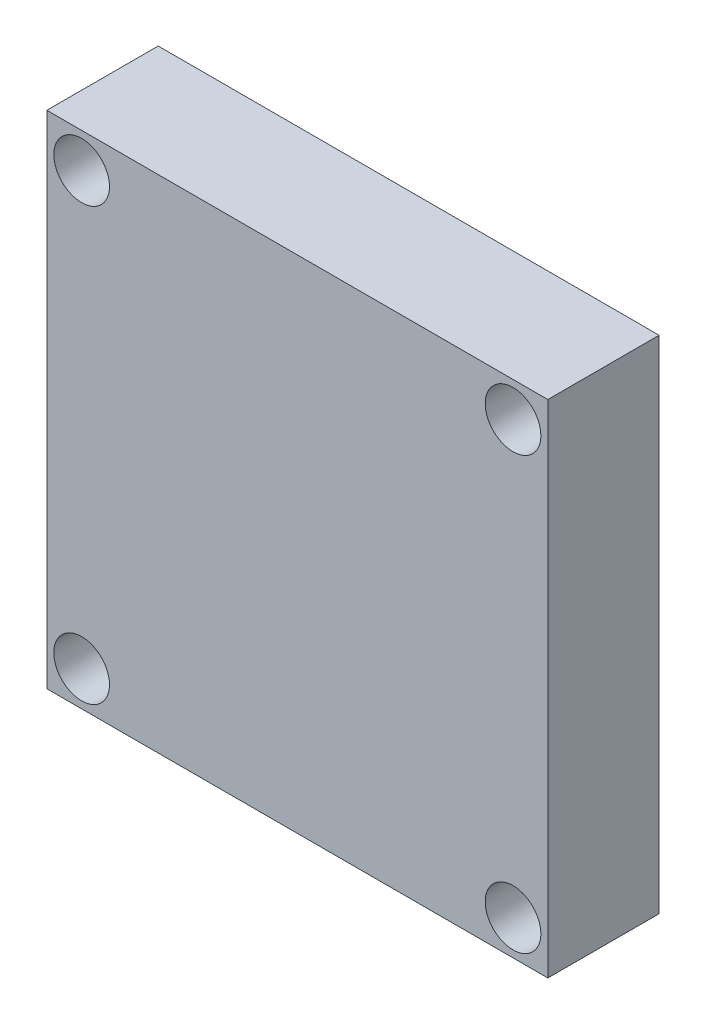
from build123d import *

# Parameters (mm, degrees)
SKETCH1_W           = 36
SKETCH1_H           = 36
SKETCH1_R           = 2
BOSS_EXTRUDE1_DEPTH = 4


with BuildPart() as part:
    # Sketch1 → Boss-Extrude1 (new, symmetric)
    with BuildSketch(Plane.XY):
        Rectangle(SKETCH1_W, SKETCH1_H)
        with Locations((-15.5, -15.5)):
            Circle(SKETCH1_R, mode=Mode.SUBTRACT)
        with Locations((15.5, -15.5)):
            Circle(SKETCH1_R, mode=Mode.SUBTRACT)
        with Locations((-15.5, 15.5)):
            Circle(SKETCH1_R, mode=Mode.SUBTRACT)
        with Locations((15.5, 15.5)):
            Circle(SKETCH1_R, mode=Mode.SUBTRACT)
    extrude(amount=BOSS_EXTRUDE1_DEPTH, both=True)


solid = part.part
